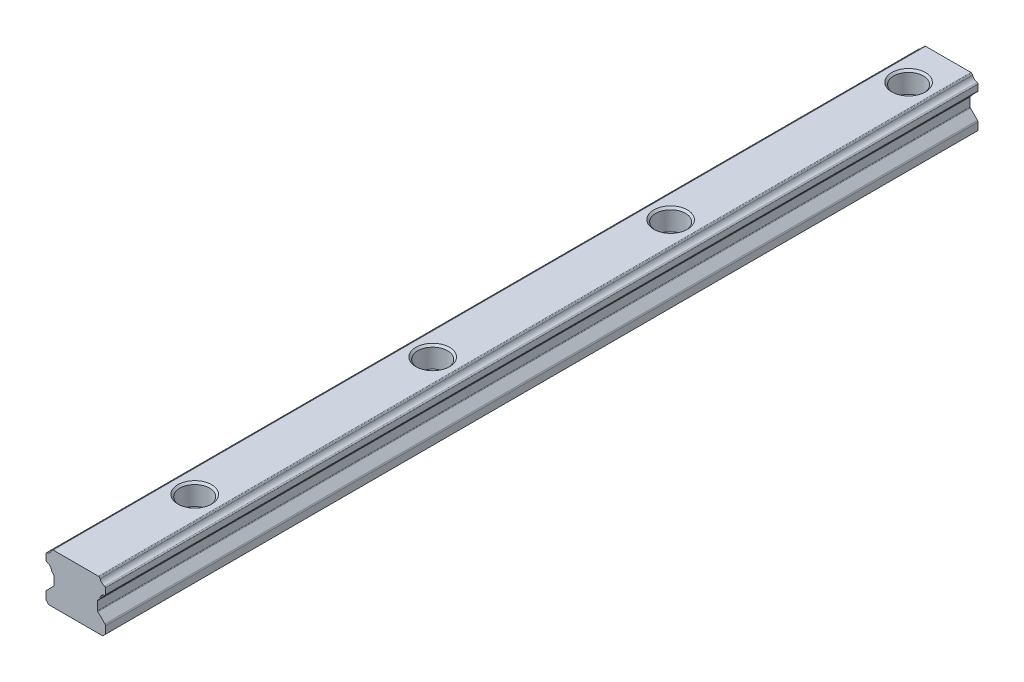
from build123d import *

# Parameters (mm, degrees)
BOSS_EXTRUDE1_DEPTH = 220
SKETCH2_R           = 3.75
CUT_EXTRUDE1_DEPTH  = 5.3
SKETCH3_R           = 2.25
CUT_EXTRUDE2_DEPTH  = 221.245522088
CHAMFER1_SIZE       = 0.5


# Read off the part's stored shape, not the designer's step: LPattern1
with BuildPart() as part:
    # Sketch1 → Boss-Extrude1 (new body)
    with BuildSketch(Plane.XY):
        with BuildLine():
            Line((-5.587867966, 4.655032034), (-7.353553391, 2.889346609))
            ThreePointArc((-7.353553391, 2.889346609), (-7.461939766, 2.727134935), (-7.5, 2.535793219))
            Line((-7.5, 2.535793219), (-7.5, 0.7))
            Line((-7.5, 0.7), (-6.8, 0))
            Line((-6.8, 0), (6.8, 0))
            Line((6.8, 0), (7.5, 0.7))
            Line((7.5, 0.7), (7.5, 2.535793219))
            ThreePointArc((7.5, 2.535793219), (7.461939766, 2.727134935), (7.353553391, 2.889346609))
            Line((7.353553391, 2.889346609), (5.587867966, 4.655032034))
            ThreePointArc((5.587867966, 4.655032034), (5.52283614, 4.752359039), (5.5, 4.867164069))
            Line((5.5, 4.867164069), (5.5, 7.007735931))
            ThreePointArc((5.5, 7.007735931), (5.52283614, 7.122540961), (5.587867966, 7.219867966))
            Line((5.587867966, 7.219867966), (6.022194074, 7.654194074))
            ThreePointArc((6.022194074, 7.654194074), (6.08029105, 7.736033047), (6.108143767, 7.832454529))
            ThreePointArc((6.108143767, 7.832454529), (6.479087517, 8.641867539), (7.257052023, 9.074903237))
            ThreePointArc((7.257052023, 9.074903237), (7.431425589, 9.178529998), (7.5, 9.369428391))
            Line((7.5, 9.369428391), (7.5, 10.830571609))
            ThreePointArc((7.5, 10.830571609), (7.431425589, 11.021470002), (7.257052023, 11.125096763))
            ThreePointArc((7.257052023, 11.125096763), (6.568589176, 11.46951378), (6.158449701, 12.120965838))
            ThreePointArc((6.158449701, 12.120965838), (6.128637664, 12.188930096), (6.0830537, 12.2474963))
            Line((6.0830537, 12.2474963), (5.918417966, 12.412132034))
            ThreePointArc((5.918417966, 12.412132034), (5.821090961, 12.47716386), (5.706285931, 12.5))
            Line((5.706285931, 12.5), (-5.706285931, 12.5))
            ThreePointArc((-5.706285931, 12.5), (-5.821090961, 12.47716386), (-5.918417966, 12.412132034))
            Line((-5.918417966, 12.412132034), (-6.0830537, 12.2474963))
            ThreePointArc((-6.0830537, 12.2474963), (-6.128637664, 12.188930096), (-6.158449701, 12.120965838))
            ThreePointArc((-6.158449701, 12.120965838), (-6.568589176, 11.46951378), (-7.257052023, 11.125096763))
            ThreePointArc((-7.257052023, 11.125096763), (-7.431425589, 11.021470002), (-7.5, 10.830571609))
            Line((-7.5, 10.830571609), (-7.5, 9.369428391))
            ThreePointArc((-7.5, 9.369428391), (-7.431425589, 9.178529998), (-7.257052023, 9.074903237))
            ThreePointArc((-7.257052023, 9.074903237), (-6.479087517, 8.641867539), (-6.108143767, 7.832454529))
            ThreePointArc((-6.108143767, 7.832454529), (-6.08029105, 7.736033047), (-6.022194074, 7.654194074))
            Line((-6.022194074, 7.654194074), (-5.587867966, 7.219867966))
            ThreePointArc((-5.587867966, 7.219867966), (-5.52283614, 7.122540961), (-5.5, 7.007735931))
            Line((-5.5, 7.007735931), (-5.5, 4.867164069))
            ThreePointArc((-5.5, 4.867164069), (-5.52283614, 4.752359039), (-5.587867966, 4.655032034))
        make_face()
    extrude(amount=BOSS_EXTRUDE1_DEPTH)

    # Sketch2 → Cut-Extrude1 (cut)
    with BuildSketch(Plane(origin=(0, 12.5, 0), x_dir=(1, 0, 0), z_dir=(0, 1, 0))):
        with Locations(Location((0, -10, 0), (0, 0, 270))):
            Circle(SKETCH2_R)
    extrude(amount=-CUT_EXTRUDE1_DEPTH, mode=Mode.SUBTRACT)

    # Sketch3 → Cut-Extrude2 (cut, through all)
    with BuildSketch(Plane(origin=(0, 7.2, 0), x_dir=(1, 0, 0), z_dir=(0, 1, 0))):
        with Locations(Location((0, -10, 0), (0, 0, 270))):
            Circle(SKETCH3_R)
    extrude(amount=-CUT_EXTRUDE2_DEPTH, mode=Mode.SUBTRACT)

    # Chamfer1
    chamfer1_edges = [part.edges().sort_by_distance(p)[0] for p in [
        (0, 12.5, 6.25),
        (0, 0, 7.75),
    ]]
    chamfer(chamfer1_edges, length=CHAMFER1_SIZE)

    # LPattern1 outline → LPattern1 (revolve, cut)
    with BuildSketch(Plane.XY.offset(190)):
        Polygon((0, 0), (2.75, 0), (2.25, 0.5), (2.25, 7.2), (3.75, 7.2), (3.75, 12), (4.25, 12.5), (0, 12.5), align=None)
    revolve(axis=Axis((0, 0, 190), (0, 1, 0)), mode=Mode.SUBTRACT)

    # LPattern1 2 outline → LPattern1 2 (revolve, cut)
    with BuildSketch(Plane.XY.offset(130)):
        Polygon((0, 12.5), (0, 0), (2.75, 0), (2.25, 0.5), (2.25, 7.2), (3.75, 7.2), (3.75, 12), (4.25, 12.5), align=None)
    revolve(axis=Axis((0, 0, 130), (0, 1, 0)), mode=Mode.SUBTRACT)

    # LPattern1 3 outline → LPattern1 3 (revolve, cut)
    with BuildSketch(Plane.XY.offset(70)):
        Polygon((0, 12.5), (0, 0), (2.75, 0), (2.25, 0.5), (2.25, 7.2), (3.75, 7.2), (3.75, 12), (4.25, 12.5), align=None)
    revolve(axis=Axis((0, 0, 70), (0, 1, 0)), mode=Mode.SUBTRACT)


solid = part.part
